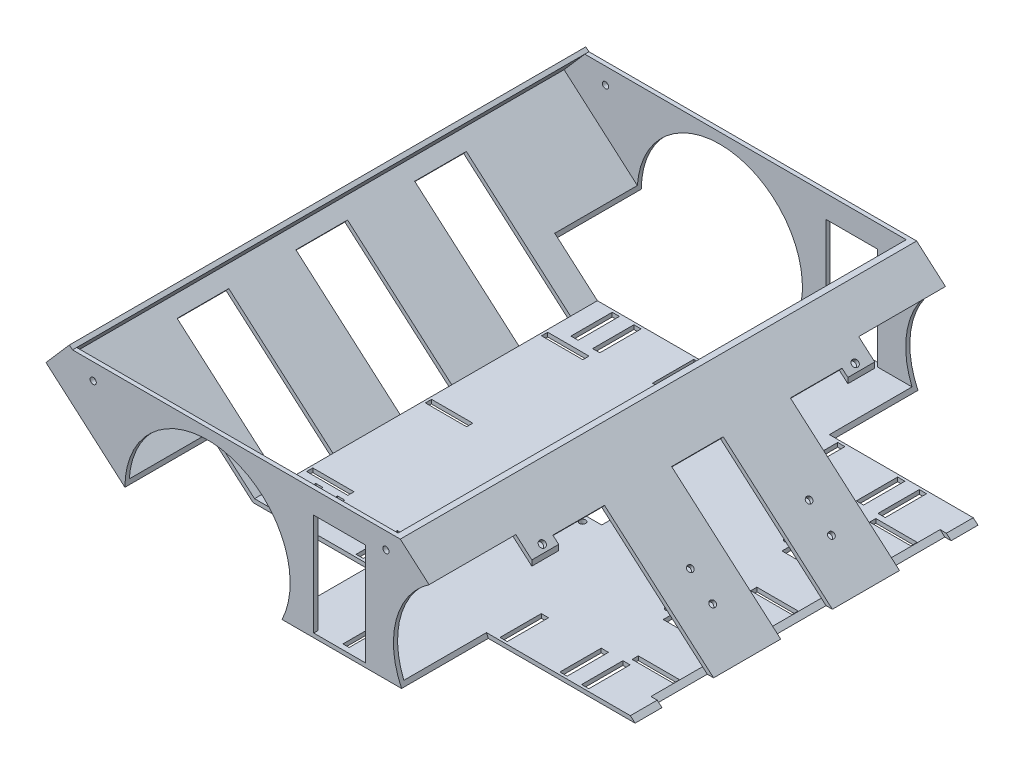
from build123d import *

# Parameters (mm, degrees)
EXTRUDE_1_DEPTH           = 250
SHELL_1_T                 = -2
SKETCH_4_R                = 40
CUT_EXTRUDE_3_DEPTH       = 42
CUT_EXTRUDE_START         = -42
SKETCH_6_R                = 40
CUT_EXTRUDE_5_DEPTH       = 42
SKETCH_7_R                = 1.5
SKETCH_7_W                = 3.5
SKETCH_7_H                = 20
SKETCH_7_W_2              = 12
SKETCH_7_W_3              = 20
SKETCH_7_H_2              = 12
CUT_EXTRUDE_6_DEPTH       = 32
SKETCH_8_W                = 50
SKETCH_8_H                = 50
CUT_EXTRUDE_7_DEPTH       = 15
SKETCH_9_W                = 50
SKETCH_9_H                = 48
CUT_EXTRUDE_8_DEPTH       = 15
SKETCH_10_W               = 70
SKETCH_10_H               = 25
CUT_EXTRUDE_9_DEPTH       = 2
SKETCH_13_W               = 25
SKETCH_13_H               = 49.428785774
CUT_EXTRUDE_10_DEPTH      = 304
SKETCH_14_W               = 66.85616243
SKETCH_14_H               = 25
CUT_EXTRUDE_11_DEPTH      = 2
SKETCH_15_W               = 3
SKETCH_15_H               = 20
SKETCH_15_W_2             = 20
SKETCH_15_H_2             = 3
CUT_EXTRUDE_12_DEPTH      = 2
SKETCH_16_R               = 1.5
CUT_EXTRUDE_13_DEPTH      = 90
SKETCH_18_R               = 1.6
CUT_EXTRUDE_14_DEPTH      = 5
CUT_EXTRUDE_15_DEPTH      = 264
SKETCH_20_W               = 250
SKETCH_20_H               = 17.277243338
EXTRUDE_2_DEPTH           = 2
CUT_EXTRUDE_17_DEPTH      = 355.541001798
CUT_EXTRUDE_17_DEPTH_BACK = 355.541001798
SKETCH_21_R               = 1.5


with BuildPart() as part:
    # 草图1 → 凸台-拉伸1 (new body)
    with BuildSketch(Plane.XY):
        Polygon((0, 0), (-185, 0), (-256.697410121, 62.325607754), (-71.697410121, 62.325607754), align=None)
    extrude(amount=EXTRUDE_1_DEPTH)

    # 抽壳1
    shell_1_openings = [part.faces().sort_by_distance(p)[0] for p in [
        (-164.197410121, 62.325607754, 125),
    ]]
    offset(amount=SHELL_1_T, openings=shell_1_openings, kind=Kind.INTERSECTION)

    # 草图4 → 切除-拉伸3 (cut)
    with BuildSketch(Plane.XY.offset(250)):
        with Locations((-35, 17.3)):
            Circle(SKETCH_4_R)
        with Locations((-165, 17.3)):
            Circle(SKETCH_4_R)
    extrude(amount=-CUT_EXTRUDE_3_DEPTH, mode=Mode.SUBTRACT)

    # 草图6 → 切除-拉伸5 (cut)
    with BuildSketch(Plane(origin=(0, 0, 0), x_dir=(-1, 0, 0), z_dir=(0, 0, -1)).offset(CUT_EXTRUDE_START)):
        with Locations((165, 17.3)):
            Circle(SKETCH_6_R)
        with BuildLine():
            ThreePointArc((15.18510716, -17.447230418), (75, 17.3), (15.18510716, 52.047230418))
            ThreePointArc((15.18510716, 52.047230418), (-45.184680822, 17.3), (15.18510716, -17.447230418))
        make_face()
    extrude(amount=CUT_EXTRUDE_5_DEPTH, mode=Mode.SUBTRACT)

    # 草图7 → 切除-拉伸6 (cut)
    with BuildSketch(Plane(origin=(0, 2, 0), x_dir=(1, 0, 0), z_dir=(0, 1, 0))):
        with Locations((-95.174280419, -111.75)):
            Circle(SKETCH_7_R)
        with Locations((-95.174280419, -138.25)):
            Circle(SKETCH_7_R)
        with Locations((-11.41, -96.25)):
            Circle(SKETCH_7_R)
        with Locations((-37.91, -96.25)):
            Circle(SKETCH_7_R)
        with Locations((-37.91, -153.75)):
            Circle(SKETCH_7_R)
        with Locations((-11.41, -153.75)):
            Circle(SKETCH_7_R)
        with Locations((-174.09, -196.75)):
            Rectangle(SKETCH_7_W, SKETCH_7_H)
        with Locations((-25.41, -196.75)):
            Rectangle(SKETCH_7_W, SKETCH_7_H)
        with Locations((-163.59, -196.75)):
            Rectangle(SKETCH_7_W, SKETCH_7_H)
        with Locations((-134.59, -196.75)):
            Rectangle(SKETCH_7_W, SKETCH_7_H)
        with Locations((-35.91, -196.75)):
            Rectangle(SKETCH_7_W, SKETCH_7_H)
        with Locations((-64.91, -196.75)):
            Rectangle(SKETCH_7_W, SKETCH_7_H)
        with Locations((-134.59, -53.25)):
            Rectangle(SKETCH_7_W, SKETCH_7_H)
        with Locations((-163.59, -53.25)):
            Rectangle(SKETCH_7_W, SKETCH_7_H)
        with Locations((-174.09, -53.25)):
            Rectangle(SKETCH_7_W, SKETCH_7_H)
        with Locations((-64.91, -53.25)):
            Rectangle(SKETCH_7_W, SKETCH_7_H)
        with Locations((-35.91, -53.25)):
            Rectangle(SKETCH_7_W, SKETCH_7_H)
        with Locations((-25.41, -53.25)):
            Rectangle(SKETCH_7_W, SKETCH_7_H)
        with Locations((-95.174280419, -125)):
            Rectangle(SKETCH_7_W_2, SKETCH_7_H)
        with Locations((-24.66, -96.25)):
            Rectangle(SKETCH_7_W_3, SKETCH_7_H_2)
        with Locations((-24.66, -153.75)):
            Rectangle(SKETCH_7_W_3, SKETCH_7_H_2)
    extrude(amount=-CUT_EXTRUDE_6_DEPTH, mode=Mode.SUBTRACT)

    # 草图8 → 切除-拉伸7 (cut)
    with BuildSketch(Plane.XY.offset(208)):
        with Locations((-25, 27)):
            Rectangle(SKETCH_8_W, SKETCH_8_H)
    extrude(amount=-CUT_EXTRUDE_7_DEPTH, mode=Mode.SUBTRACT)

    # 草图9 → 切除-拉伸8 (cut)
    with BuildSketch(Plane(origin=(0, 0, 42), x_dir=(-1, 0, 0), z_dir=(0, 0, -1))):
        with Locations((25, 26)):
            Rectangle(SKETCH_9_W, SKETCH_9_H)
    extrude(amount=-CUT_EXTRUDE_8_DEPTH, mode=Mode.SUBTRACT)

    # 草图10 → 切除-拉伸9 (cut)
    with BuildSketch(Plane(origin=(0, 0, 0), x_dir=(0.7547095802227755, -0.6560590289905034, 0), z_dir=(0.6560590289905034, 0.7547095802227755, 0))):
        with Locations((-35, -182.5)):
            Rectangle(SKETCH_10_W, SKETCH_10_H)
        with Locations((-35, -67.5)):
            Rectangle(SKETCH_10_W, SKETCH_10_H)
        with Locations((-35, -125)):
            Rectangle(SKETCH_10_W, SKETCH_10_H)
    extrude(amount=-CUT_EXTRUDE_9_DEPTH, mode=Mode.SUBTRACT)

    # 草图13 → 切除-拉伸10 (cut)
    with BuildSketch(Plane(origin=(0, 0, 0), x_dir=(-1, 0, 0), z_dir=(0, 0, -1))):
        with Locations((101.10376969, 26.714392887)):
            Rectangle(SKETCH_13_W, SKETCH_13_H)
    extrude(amount=-CUT_EXTRUDE_10_DEPTH, mode=Mode.SUBTRACT)

    # 草图14 → 切除-拉伸11 (cut)
    with BuildSketch(Plane(origin=(-78.314370103, -90.090377198, 0), x_dir=(0.7547095802227756, -0.6560590289905033, 0), z_dir=(0.6560590289905033, 0.7547095802227756, 0))):
        with Locations((-173.797122915, -67.5)):
            Rectangle(SKETCH_14_W, SKETCH_14_H)
        with Locations((-173.797122915, -125)):
            Rectangle(SKETCH_14_W, SKETCH_14_H)
        with Locations((-173.797122915, -182.5)):
            Rectangle(SKETCH_14_W, SKETCH_14_H)
    extrude(amount=-CUT_EXTRUDE_11_DEPTH, mode=Mode.SUBTRACT)

    # 草图15 → 切除-拉伸12 (cut)
    with BuildSketch(Plane.XZ):
        with Locations((-100.462980788, 237.5)):
            Rectangle(SKETCH_15_W, SKETCH_15_H)
        with Locations((-15.456937779, 182.5)):
            Rectangle(SKETCH_15_W_2, SKETCH_15_H_2)
        with Locations((-15.548506173, 125)):
            Rectangle(SKETCH_15_W_2, SKETCH_15_H_2)
        with Locations((-15.548506173, 67.407755874)):
            Rectangle(SKETCH_15_W_2, SKETCH_15_H_2)
        with Locations((-100.787471441, 12.5)):
            Rectangle(SKETCH_15_W, SKETCH_15_H)
        with Locations((-173.064348699, 68.747523441)):
            Rectangle(SKETCH_15_W_2, SKETCH_15_H_2)
        with Locations((-173.064348699, 125)):
            Rectangle(SKETCH_15_W_2, SKETCH_15_H_2)
        with Locations((-173.064348699, 182.5)):
            Rectangle(SKETCH_15_W_2, SKETCH_15_H_2)
    extrude(amount=-CUT_EXTRUDE_12_DEPTH, mode=Mode.SUBTRACT)

    # 草图16 → 切除-拉伸13 (cut)
    with BuildSketch(Plane(origin=(-1.312118058, -1.50941916, 0), x_dir=(0.7547095802227755, -0.6560590289905034, 0), z_dir=(-0.6560590289905034, -0.7547095802227755, 0))):
        with Locations((-22.161189798, 96.25)):
            Circle(SKETCH_16_R)
        with Locations((-36.461189798, 96.25)):
            Circle(SKETCH_16_R)
        with Locations((-22.161189798, 153.75)):
            Circle(SKETCH_16_R)
        with Locations((-36.461189798, 153.75)):
            Circle(SKETCH_16_R)
    extrude(amount=-CUT_EXTRUDE_13_DEPTH, mode=Mode.SUBTRACT)

    # 草图18 → 切除-拉伸14 (cut)
    with BuildSketch(Plane(origin=(0, 0, 0), x_dir=(0.7547095802227755, -0.6560590289905034, 0), z_dir=(0.6560590289905034, 0.7547095802227755, 0))):
        with Locations((-69.177168292, -200.735802704)):
            Circle(SKETCH_18_R)
        with Locations((-69.177168292, -49.264197296)):
            Circle(SKETCH_18_R)
    extrude(amount=-CUT_EXTRUDE_14_DEPTH, mode=Mode.SUBTRACT)

    # 草图19 → 切除-拉伸15 (cut)
    with BuildSketch(Plane.XY.offset(250)):
        Polygon((-256.697410121, 62.325607754), (-241.697410121, 62.325607754), (-230.362518633, 62.325607754), (-241.697410121, 49.286306687), align=None)
    extrude(amount=-CUT_EXTRUDE_15_DEPTH, mode=Mode.SUBTRACT)

    # 草图20 → 凸台-拉伸2 (add)
    with BuildSketch(Plane(origin=(-162.07092196, 140.886103045, 0), x_dir=(0, 0, 1), z_dir=(-0.7547095802227756, 0.6560590289905032, 0))):
        with Locations((125, -112.732298694)):
            Rectangle(SKETCH_20_W, SKETCH_20_H)
    extrude(amount=EXTRUDE_2_DEPTH)

    # 草图21 → 切除-拉伸17 (cut, two sides: drawn at the far end of the back side and taken through both)
    with BuildSketch(Plane.XY.offset(250).offset(-CUT_EXTRUDE_17_DEPTH_BACK)):
        with Locations((-78.60376969, 54.325607754)):
            Circle(SKETCH_21_R)
        with Locations((-220.362518633, 54.325607754)):
            Circle(SKETCH_21_R)
    extrude(amount=CUT_EXTRUDE_17_DEPTH + CUT_EXTRUDE_17_DEPTH_BACK, mode=Mode.SUBTRACT)


solid = part.part
